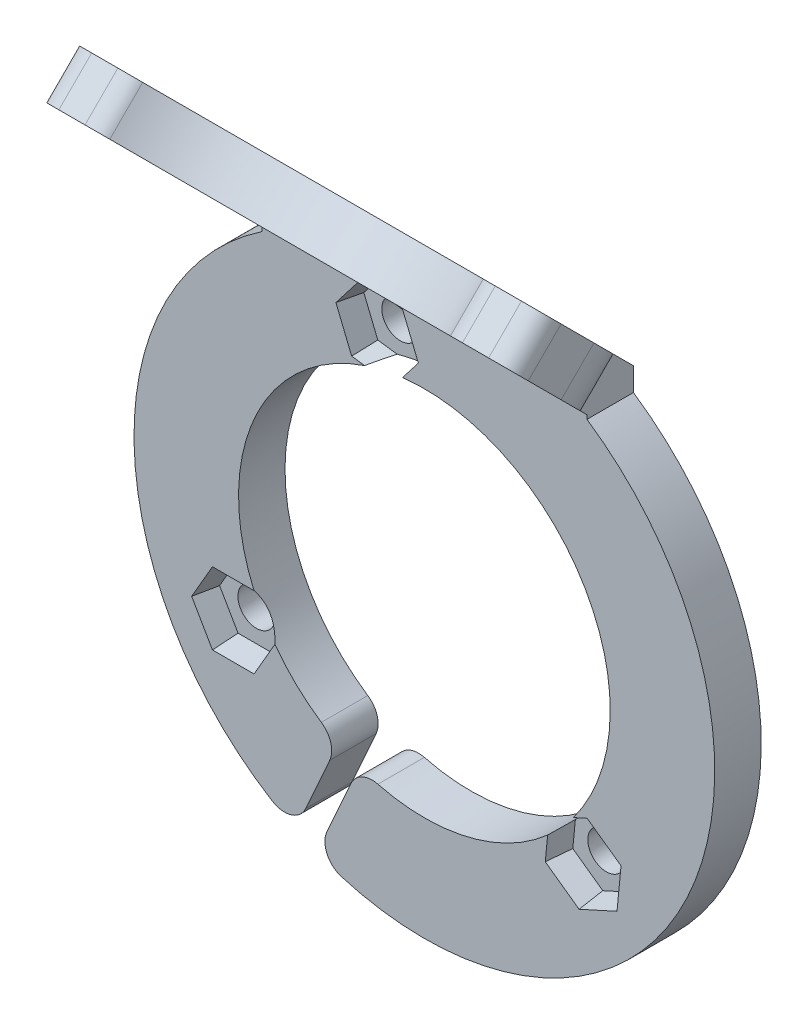
from build123d import *

# Parameters (mm, degrees)
SKETCH1_R                = 25
SKETCH1_R_2              = 16
BOSS_EXTRUDE1_DEPTH      = 4
SKETCH2_R                = 1.6
CUT_EFFECTOR_HOLES_DEPTH = 36.580893749
SKETCH10_W               = 28
SKETCH10_H               = 4.287684823
CUT_EXTRUDE6_DEPTH       = 36.580893749
SKETCH3_W                = 28
SKETCH3_H                = 2
BOSS_FAN_EXTENSION_DEPTH = 4
BOSS_FAN_BOSS_DEPTH      = 4
CUT_FAN_SCREW_REACH      = 54.433
SKETCH5_R                = 2
CUT_FAN_HOLE_REACH       = 54.433
SKETCH6_R                = 18.5
FILLET1_R                = 2
CUT_EXTRUDE4_OUTLINE_R   = 1.6
CUT_EXTRUDE4_DEPTH       = 2
CUT_EXTRUDE4_DRAFT       = 10
CUT_EXTRUDE4_2_OUTLINE_R = 1.6
CUT_EXTRUDE4_2_DEPTH     = 2.484285969
CUT_EXTRUDE4_2_DRAFT     = 10
CUT_EXTRUDE4_3_OUTLINE_R = 1.6
CUT_EXTRUDE4_3_DEPTH     = 2
CUT_EXTRUDE4_3_DRAFT     = 10
CUT_EXTRUDE5_REACH       = 49.658
FILLET2_R                = 2
CUT_EXTRUDE7_DEPTH       = 2
CUT_EXTRUDE7_DRAFT       = -10
CUT_EXTRUDE7_2_DEPTH     = 2
CUT_EXTRUDE7_2_DRAFT     = -10


# Read off the part's stored shape, not the designer's step: Cut-Extrude4, Cut-Extrude7
with BuildPart() as part:
    # Sketch1 → Boss-Extrude1 (new body)
    with BuildSketch(Plane.XY):
        Circle(SKETCH1_R)
        Circle(SKETCH1_R_2, mode=Mode.SUBTRACT)
    extrude(amount=BOSS_EXTRUDE1_DEPTH)

    # Sketch2 → Cut-Effector Holes (cut, through all)
    with BuildSketch(Plane(origin=(0, 0, 0), x_dir=(-1, 0, 0), z_dir=(0, 0, -1))):
        with Locations((4.067203991, 18.133126642)):
            Circle(SKETCH2_R)
        with Locations((-13.670146326, -12.588865299)):
            Circle(SKETCH2_R)
        with Locations((16.454482672, -9.5)):
            Circle(SKETCH2_R)
    extrude(amount=-CUT_EFFECTOR_HOLES_DEPTH, mode=Mode.SUBTRACT)

    # Sketch10 → Cut-Extrude6 (cut, through all)
    with BuildSketch(Plane(origin=(0, 0, 0), x_dir=(-1, 0, 0), z_dir=(0, 0, -1))):
        with Locations((0, 22.856157589)):
            Rectangle(SKETCH10_W, SKETCH10_H)
    extrude(amount=-CUT_EXTRUDE6_DEPTH, mode=Mode.SUBTRACT)

    # Sketch3 → Boss-Fan Extension (add, through all)
    with BuildSketch(Plane.XY):
        with Locations((0, 21.712315177)):
            Rectangle(SKETCH3_W, SKETCH3_H)
    extrude(amount=BOSS_FAN_EXTENSION_DEPTH)

    # Sketch4 → Boss-Fan Boss (add)
    with BuildSketch(Plane(origin=(0, 11.356157589, -11.356157589), x_dir=(-1, 0, 0), z_dir=(0, 0.7071067811865464, -0.7071067811865488))):
        with BuildLine():
            Line((-20.5, 30.060032078), (-20.5, 36.060032078))
            Line((-20.5, 36.060032078), (20.5, 36.060032078))
            Line((20.5, 36.060032078), (20.5, 30.060032078))
            add(Edge.make_bspline(
                [(14, 18.888459203), (14, 26.407165397), (20.5, 22.786539918), (20.5, 30.060032078)],
                knots=[0, 0, 0, 0, 1, 1, 1, 1], degree=3))
            Line((14, 18.888459203), (14, 16.060032078))
            Line((14, 16.060032078), (-14, 16.060032078))
            Line((-14, 16.060032078), (-14, 18.888459203))
            add(Edge.make_bspline(
                [(-14, 18.888459203), (-14, 26.407165397), (-20.5, 22.786539918), (-20.5, 30.060032078)],
                knots=[0, 0, 0, 0, 1, 1, 1, 1], degree=3))
        make_face()
    extrude(amount=-BOSS_FAN_BOSS_DEPTH)

    # Sketch5 → Cut-Fan Screw (cut, up to next)
    with BuildSketch(Plane(origin=(0, 11.356157589, -11.356157589), x_dir=(1, 0, 0), z_dir=(0, 0.7071067811865466, -0.7071067811865485)), mode=Mode.PRIVATE) as cut_fan_screw_sk1:
        with Locations(Location((-16.5, -30.060032078, 0), (0, 0, 270))):
            Circle(SKETCH5_R)
    cut_fan_screw_tool1 = extrude(cut_fan_screw_sk1.sketch, amount=-CUT_FAN_SCREW_REACH, mode=Mode.PRIVATE) & part.part
    cut_fan_screw = cut_fan_screw_tool1.solids().sort_by_distance((-16.5, 32.61181, 9.899495))[0]
    add(cut_fan_screw, mode=Mode.SUBTRACT)

    # Mirror-Fan Screw: Cut-Fan Screw across plane
    add(cut_fan_screw.mirror(Plane(origin=(0, 0, 0), x_dir=(0, 0, 1), z_dir=(1, 0, 0))), mode=Mode.SUBTRACT)

    # Sketch6 → Cut-Fan Hole (cut, up to next)
    with BuildSketch(Plane(origin=(0, 11.356157589, -11.356157589), x_dir=(1, 0, 0), z_dir=(0, 0.7071067811865466, -0.7071067811865485)), mode=Mode.PRIVATE) as cut_fan_hole_sk1:
        with Locations((0, -46.560032078)):
            Circle(SKETCH6_R)
    cut_fan_hole_tool1 = extrude(cut_fan_hole_sk1.sketch, amount=-CUT_FAN_HOLE_REACH, mode=Mode.PRIVATE) & part.part
    add(cut_fan_hole_tool1.solids().sort_by_distance((0, 44.279072, 21.566757))[0], mode=Mode.SUBTRACT)

    # Fillet1
    fillet1_edges = [part.edges().sort_by_distance(p)[0] for p in [
        (20.5, 35.440237239, 15.556349186),
        (-20.5, 35.440237239, 15.556349186),
        (15.231546212, 35.440237239, 15.556349186),
        (-15.231546212, 35.440237239, 15.556349186),
    ]]
    fillet(fillet1_edges, radius=FILLET1_R)


with BuildPart() as cut_extrude4_tool:
    # Cut-Extrude4 outline → Cut-Extrude4 (with draft: the straight prism first)
    with BuildSketch(Plane(origin=(0, 0, 2), x_dir=(-1, 0, 0), z_dir=(0, 0, -1))):
        with BuildLine():
            ThreePointArc((-11.002045698, -11.617012975), (-11.701394046, -10.912258124), (-12.355684371, -10.165483939))
            Line((-12.355684371, -10.165483939), (-13.979106464, -9.42850504))
            Line((-13.979106464, -9.42850504), (-16.561578664, -11.276252498))
            Line((-16.561578664, -11.276252498), (-16.252618527, -14.436612757))
            Line((-16.252618527, -14.436612757), (-13.361186189, -15.749225558))
            Line((-13.361186189, -15.749225558), (-10.778713988, -13.901478101))
            Line((-10.778713988, -13.901478101), (-11.002045698, -11.617012975))
        make_face()
        with Locations((-13.670146326, -12.588865299)):
            Circle(CUT_EXTRUDE4_OUTLINE_R, mode=Mode.SUBTRACT)
    extrude(amount=-CUT_EXTRUDE4_DEPTH)
    # Cut-Extrude4: the draft: its side faces are tilted about the plane it starts from
    cut_extrude4_sides = [cut_extrude4_tool.faces().sort_by_distance(p)[0] for p in [
        (16.407098595, -12.856432627, 3),
        (14.806902358, -15.092919158, 3),
        (12.069950089, -14.825351829, 3),
        (10.890379843, -12.759245538, 3),
        (11.701394046, -10.912258124, 3),
        (13.167395417, -9.796994489, 3),
        (15.270342564, -10.352378769, 3),
        (15.270146326, -12.588865299, 3),
    ]]
    draft(cut_extrude4_sides, Plane(origin=(0, 0, 2), x_dir=(-1, 0, 0), z_dir=(0, 0, -1)), CUT_EXTRUDE4_DRAFT)


with BuildPart() as part_1:
    add(part.part)

    # Cut-Extrude4: cut by cut_extrude4_tool
    add(cut_extrude4_tool.part, mode=Mode.SUBTRACT)


with BuildPart() as cut_extrude4_2_tool:
    # Cut-Extrude4 2 outline → Cut-Extrude4 2 (with draft: the straight prism first)
    with BuildSketch(Plane(origin=(0, 0, 2), x_dir=(-1, 0, 0), z_dir=(0, 0, -1))):
        with BuildLine():
            ThreePointArc((2.378102624, 15.822282639), (3.371999625, 15.640639965), (4.352450444, 15.396628694))
            Line((4.352450444, 15.396628694), (6.010326315, 15.621631277))
            Line((6.010326315, 15.621631277), (7.21378394, 18.560172255))
            Line((7.21378394, 18.560172255), (5.270661616, 21.071667619))
            Line((5.270661616, 21.071667619), (2.124081667, 20.644622006))
            Line((2.124081667, 20.644622006), (0.920624042, 17.706081029))
            Line((0.920624042, 17.706081029), (2.378102624, 15.822282639))
        make_face()
        with Locations((4.067203991, 18.133126642)):
            Circle(CUT_EXTRUDE4_2_OUTLINE_R, mode=Mode.SUBTRACT)
    extrude(amount=-CUT_EXTRUDE4_2_DEPTH)
    # Cut-Extrude4 2: the draft: its side faces are tilted about the plane it starts from
    cut_extrude4_2_sides = [cut_extrude4_2_tool.faces().sort_by_distance(p)[0] for p in [
        (-6.242222778, 19.815919937, 3.242142985),
        (-3.697371642, 20.858144812, 3.242142985),
        (-1.522352855, 19.175351517, 3.242142985),
        (-1.649363333, 16.764181834, 3.242142985),
        (-3.371999625, 15.640639965, 3.242142985),
        (-5.18138838, 15.509129986, 3.242142985),
        (-6.612055127, 17.090901766, 3.242142985),
        (-2.467203991, 18.133126642, 3.242142985),
    ]]
    draft(cut_extrude4_2_sides, Plane(origin=(0, 0, 2), x_dir=(-1, 0, 0), z_dir=(0, 0, -1)), CUT_EXTRUDE4_2_DRAFT)


with BuildPart() as part_2:
    add(part_1.part)

    # Cut-Extrude4 2: cut by cut_extrude4_2_tool
    add(cut_extrude4_2_tool.part, mode=Mode.SUBTRACT)


with BuildPart() as cut_extrude4_3_tool:
    # Cut-Extrude4 3 outline → Cut-Extrude4 3 (with draft: the straight prism first)
    with BuildSketch(Plane(origin=(0, 0, 2), x_dir=(-1, 0, 0), z_dir=(0, 0, -1))):
        Polygon((18.042195912, -6.75), (14.866769432, -6.75), (13.279056191, -9.5), (14.866769432, -12.25), (18.042195912, -12.25), (19.629909152, -9.5), align=None)
        with Locations((16.454482672, -9.5)):
            Circle(CUT_EXTRUDE4_3_OUTLINE_R, mode=Mode.SUBTRACT)
    extrude(amount=-CUT_EXTRUDE4_3_DEPTH)
    # Cut-Extrude4 3: the draft: its side faces are tilted about the plane it starts from
    cut_extrude4_3_sides = [cut_extrude4_3_tool.faces().sort_by_distance(p)[0] for p in [
        (-16.454482672, -6.75, 3),
        (-14.072912812, -8.125, 3),
        (-14.072912812, -10.875, 3),
        (-16.454482672, -12.25, 3),
        (-18.836052532, -10.875, 3),
        (-18.836052532, -8.125, 3),
        (-14.854482672, -9.5, 3),
    ]]
    draft(cut_extrude4_3_sides, Plane(origin=(0, 0, 2), x_dir=(-1, 0, 0), z_dir=(0, 0, -1)), CUT_EXTRUDE4_3_DRAFT)


with BuildPart() as part_3:
    add(part_2.part)

    # Cut-Extrude4 3: cut by cut_extrude4_3_tool
    add(cut_extrude4_3_tool.part, mode=Mode.SUBTRACT)

    # Sketch8 → Cut-Extrude5 (cut, up to next)
    with BuildSketch(Plane(origin=(0, 0, 0), x_dir=(-1, 0, 0), z_dir=(0, 0, -1)), mode=Mode.PRIVATE) as cut_extrude5_sk1:
        with BuildLine():
            Line((9.279528916, -23.214011784), (5.602690803, -14.98698955))
            Line((5.602690803, -14.98698955), (7.428630962, -14.170936526))
            Line((7.428630962, -14.170936526), (11.105469075, -22.39795876))
            ThreePointArc((11.105469075, -22.39795876), (10.200662793, -22.824251983), (9.279528916, -23.214011784))
        make_face()
    cut_extrude5_tool1 = extrude(cut_extrude5_sk1.sketch, amount=-CUT_EXTRUDE5_REACH, mode=Mode.PRIVATE) & part_3.part
    add(cut_extrude5_tool1.solids().sort_by_distance((-8.356802, -18.698565, 0))[0], mode=Mode.SUBTRACT)

    # Fillet2
    fillet2_edges = [part_3.edges().sort_by_distance(p)[0] for p in [
        (-11.105469075, -22.39795876, 2),
        (-5.602690803, -14.98698955, 2),
        (-9.279528916, -23.214011784, 2),
        (-7.428630962, -14.170936526, 2),
    ]]
    fillet(fillet2_edges, radius=FILLET2_R)


with BuildPart() as cut_extrude7_tool:
    # Cut-Extrude7 outline → Cut-Extrude7 (with draft: the straight prism first)
    with BuildSketch(Plane(origin=(0, 9.941944026, -9.941944026), x_dir=(1, 0, 0), z_dir=(0, -0.7071067811865462, 0.7071067811865488))):
        Polygon((-13.8, 28.501186351), (-13.8, 31.618877805), (-16.5, 33.177723532), (-19.2, 31.618877805), (-19.2, 28.501186351), (-16.5, 26.942340625), align=None)
        with BuildLine():
            ThreePointArc((-16.5, 32.060032078), (-14.5, 30.060032078), (-16.5, 28.060032078))
            ThreePointArc((-16.5, 28.060032078), (-18.5, 30.060032078), (-16.5, 32.060032078))
        make_face(mode=Mode.SUBTRACT)
    extrude(amount=CUT_EXTRUDE7_DEPTH)
    # Cut-Extrude7: the draft: its side faces are tilted about the plane it starts from
    cut_extrude7_sides = [cut_extrude7_tool.faces().sort_by_distance(p)[0] for p in [
        (-13.8, 30.49048977, 12.02081528),
        (-16.5, 29.076276207, 10.606601718),
        (-17.85, 28.837084194, 10.367409704),
        (-19.2, 30.49048977, 12.02081528),
        (-17.85, 32.143895346, 13.674220857),
        (-15.15, 32.143895346, 13.674220857),
        (-15.15, 28.837084194, 10.367409704),
    ]]
    draft(cut_extrude7_sides, Plane(origin=(0, 9.941944026, -9.941944026), x_dir=(1, 0, 0), z_dir=(0, -0.7071067811865462, 0.7071067811865488)), CUT_EXTRUDE7_DRAFT)


with BuildPart() as part_4:
    add(part_3.part)

    # Cut-Extrude7: cut by cut_extrude7_tool
    add(cut_extrude7_tool.part, mode=Mode.SUBTRACT)


with BuildPart() as cut_extrude7_2_tool:
    # Cut-Extrude7 2 outline → Cut-Extrude7 2 (with draft: the straight prism first)
    with BuildSketch(Plane(origin=(0, 9.941944026, -9.941944026), x_dir=(1, 0, 0), z_dir=(0, -0.7071067811865462, 0.7071067811865488))):
        Polygon((19.2, 28.501186351), (19.2, 31.618877805), (16.5, 33.177723532), (13.8, 31.618877805), (13.8, 28.501186351), (16.5, 26.942340625), align=None)
        with BuildLine():
            ThreePointArc((16.5, 32.060032078), (18.5, 30.060032078), (16.5, 28.060032078))
            ThreePointArc((16.5, 28.060032078), (14.5, 30.060032078), (16.5, 32.060032078))
        make_face(mode=Mode.SUBTRACT)
    extrude(amount=CUT_EXTRUDE7_2_DEPTH)
    # Cut-Extrude7 2: the draft: its side faces are tilted about the plane it starts from
    cut_extrude7_2_sides = [cut_extrude7_2_tool.faces().sort_by_distance(p)[0] for p in [
        (19.2, 30.49048977, 12.02081528),
        (16.5, 29.076276207, 10.606601718),
        (15.15, 28.837084194, 10.367409704),
        (13.8, 30.49048977, 12.02081528),
        (15.15, 32.143895346, 13.674220857),
        (17.85, 32.143895346, 13.674220857),
        (17.85, 28.837084194, 10.367409704),
    ]]
    draft(cut_extrude7_2_sides, Plane(origin=(0, 9.941944026, -9.941944026), x_dir=(1, 0, 0), z_dir=(0, -0.7071067811865462, 0.7071067811865488)), CUT_EXTRUDE7_2_DRAFT)


with BuildPart() as part_5:
    add(part_4.part)

    # Cut-Extrude7 2: cut by cut_extrude7_2_tool
    add(cut_extrude7_2_tool.part, mode=Mode.SUBTRACT)


solid = part_5.part
